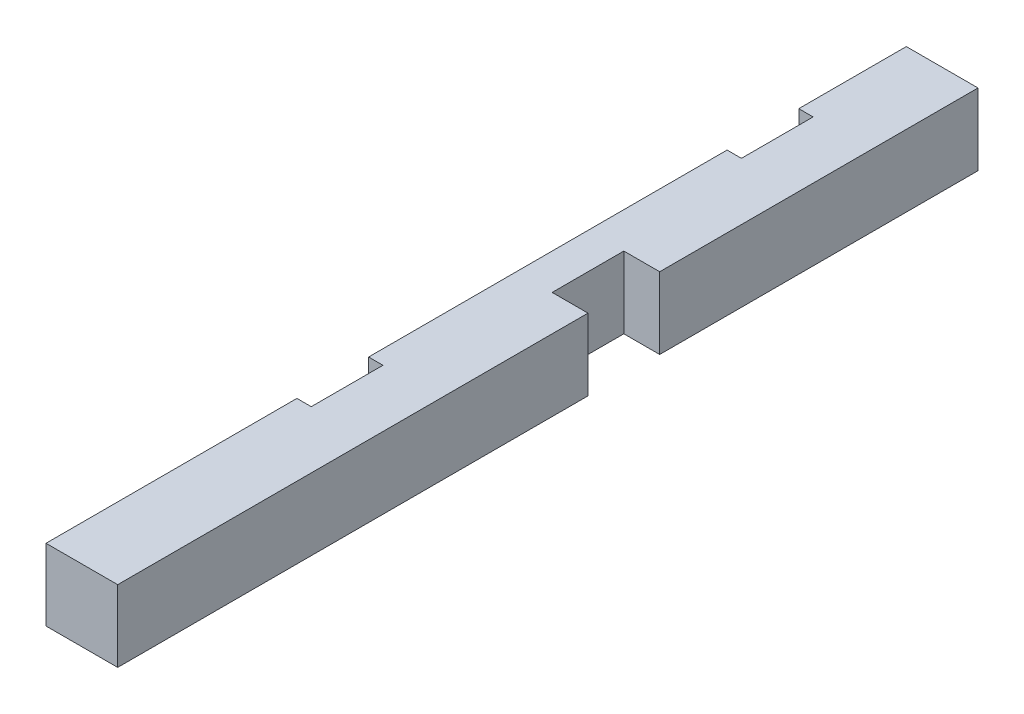
from build123d import *

# Parameters (mm, degrees)
ESQUISSE1_W             = 10
ESQUISSE1_H             = 10
BOSS_EXTRU_1_DEPTH      = 120
ESQUISSE2_W             = 5
ESQUISSE2_H             = 10
ENL_V_MAT_EXTRU_1_DEPTH = 121.830459736
ESQUISSE3_W             = 10
ESQUISSE3_H             = 10
ENL_V_MAT_EXTRU_2_DEPTH = 2
ESQUISSE4_W             = 2
ESQUISSE4_H             = 10
ENL_V_MAT_EXTRU_3_DEPTH = 121.830459736


with BuildPart() as part:
    # Esquisse1 → Boss.-Extru.1 (new body)
    with BuildSketch(Plane.XY):
        with Locations((5, 5)):
            Rectangle(ESQUISSE1_W, ESQUISSE1_H)
    extrude(amount=BOSS_EXTRU_1_DEPTH)

    # Esquisse2 → Enlèv. mat.-Extru.1 (cut, through all)
    with BuildSketch(Plane(origin=(0, 10, 0), x_dir=(1, 0, 0), z_dir=(0, 1, 0))):
        with Locations((7.5, -49.4)):
            Rectangle(ESQUISSE2_W, ESQUISSE2_H)
    extrude(amount=-ENL_V_MAT_EXTRU_1_DEPTH, mode=Mode.SUBTRACT)

    # Esquisse3 → Enlèv. mat.-Extru.2 (cut)
    with BuildSketch(Plane.ZY):
        with Locations((80, 5)):
            Rectangle(ESQUISSE3_W, ESQUISSE3_H)
    extrude(amount=-ENL_V_MAT_EXTRU_2_DEPTH, mode=Mode.SUBTRACT)

    # Esquisse4 → Enlèv. mat.-Extru.3 (cut, through all)
    with BuildSketch(Plane.XZ):
        with Locations((1, 20)):
            Rectangle(ESQUISSE4_W, ESQUISSE4_H)
    extrude(amount=-ENL_V_MAT_EXTRU_3_DEPTH, mode=Mode.SUBTRACT)


solid = part.part
